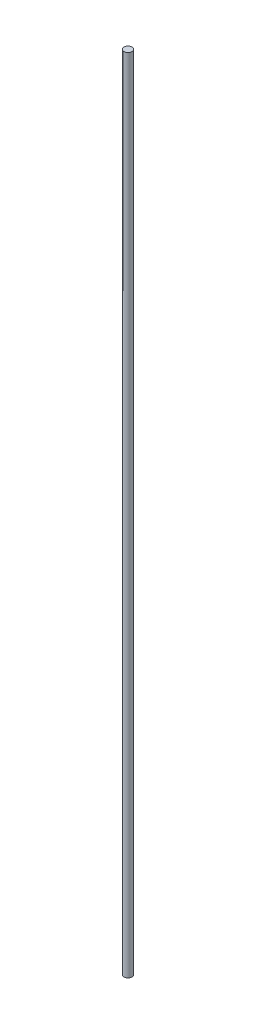
from build123d import *

# Parameters (mm, degrees)
SKETCH3_R           = 2.5
BOSS_EXTRUDE1_DEPTH = 250


with BuildPart() as part:
    # Sketch3 → Boss-Extrude1 (new, symmetric)
    with BuildSketch(Plane(origin=(0, 0, 0), x_dir=(1, 0, 0), z_dir=(0, 1, 0))):
        Circle(SKETCH3_R)
    extrude(amount=BOSS_EXTRUDE1_DEPTH, both=True)


solid = part.part
